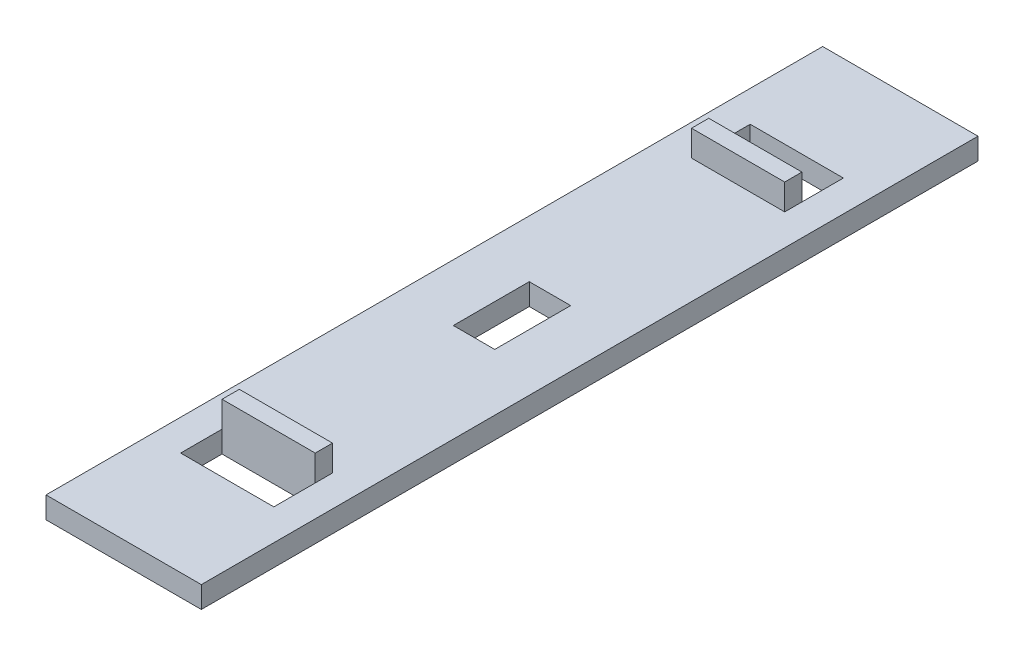
from build123d import *

# Parameters (mm, degrees)
ESQUISSE1_W                  = 9
ESQUISSE1_H                  = 45
ESQUISSE1_W_2                = 5.4
ESQUISSE1_H_2                = 2.4
BOSS_EXTRU_1_DEPTH           = 1.25
ENL_V_MAT_EXTRU_1_DEPTH      = 44.859616193
ENL_V_MAT_EXTRU_1_DEPTH_BACK = 44.859616193
ESQUISSE2_W                  = 2.4
ESQUISSE2_H                  = 4.4
ESQUISSE3_W                  = 5.4
ESQUISSE3_H                  = 1
BOSS_EXTRU_2_DEPTH           = 1.5


with BuildPart() as part:
    # Esquisse1 → Boss.-Extru.1 (new body)
    with BuildSketch(Plane(origin=(0, 0, 0), x_dir=(1, 0, 0), z_dir=(0, 1, 0))):
        with Locations((3.408982136, 20.622516556)):
            Rectangle(ESQUISSE1_W, ESQUISSE1_H)
        with Locations((3.408982136, 5.322516556)):
            Rectangle(ESQUISSE1_W_2, ESQUISSE1_H_2, mode=Mode.SUBTRACT)
        with Locations((3.408982136, 35.922516556)):
            Rectangle(ESQUISSE1_W_2, ESQUISSE1_H_2, mode=Mode.SUBTRACT)
    extrude(amount=BOSS_EXTRU_1_DEPTH)

    # Esquisse2 → Enlèv. mat.-Extru.1 (cut, two sides: drawn at the far end of the back side and taken through both)
    with BuildSketch(Plane.XZ.offset(-ENL_V_MAT_EXTRU_1_DEPTH_BACK)):
        with Locations((3.408982136, -20.622516556)):
            Rectangle(ESQUISSE2_W, ESQUISSE2_H)
    extrude(amount=ENL_V_MAT_EXTRU_1_DEPTH + ENL_V_MAT_EXTRU_1_DEPTH_BACK, mode=Mode.SUBTRACT)

    # Esquisse3 → Boss.-Extru.2 (add)
    with BuildSketch(Plane(origin=(0, 1.25, 0), x_dir=(1, 0, 0), z_dir=(0, 1, 0))):
        with Locations((3.408982136, 7.022516556)):
            Rectangle(ESQUISSE3_W, ESQUISSE3_H)
        with Locations((3.408982136, 34.222516556)):
            Rectangle(ESQUISSE3_W, ESQUISSE3_H)
    extrude(amount=BOSS_EXTRU_2_DEPTH)


solid = part.part
